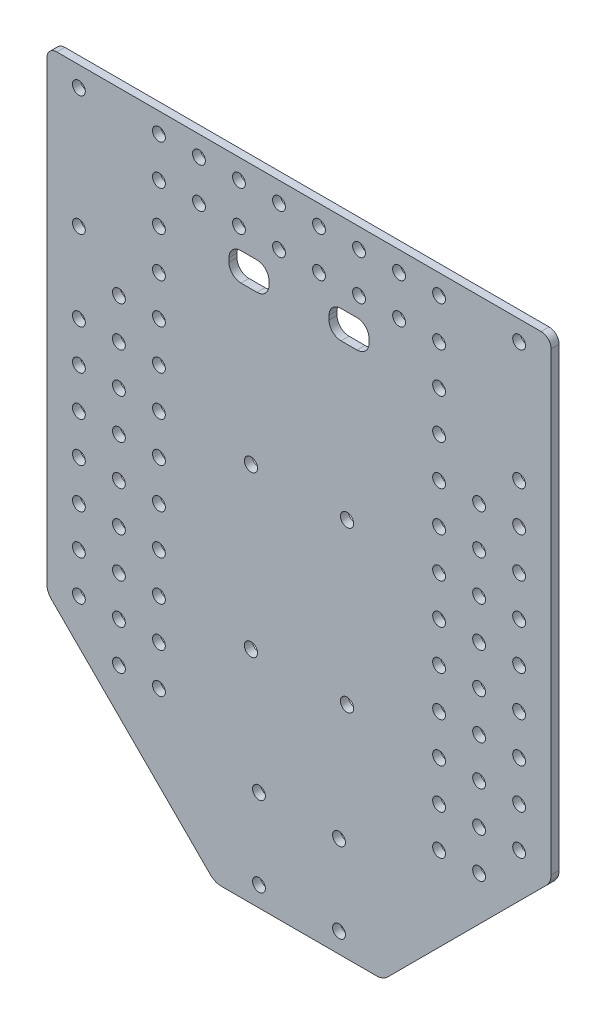
from build123d import *

# Parameters (mm, degrees)
SKETCH_1_W              = 126
SKETCH_1_H              = 160
EXTRUDE_428_DEPTH       = 2
CUT_EXTRUDE_998_REACH   = 173.968
SKETCH_2_R              = 1.6
SKETCH_3_R              = 1.65
CUT_EXTRUDE_1272_DEPTH  = 172.968020283
CHAMFER_2_SIZE          = 42
CHAMFER_1_SIZE          = 42
FILLET_1_R              = 4
SKETCH_6_W              = 10
SKETCH_6_H              = 7
CUT_EXTRUDE_2010_DEPTH  = 172.968020283
SKETCH_4_R              = 1.6
CUT_EXTRUDE_10_10_DEPTH = 172.968020283
FILLET_2_R              = 3
FILLET_3_R              = 2.5


with BuildPart() as part:
    # Эскиз1 → Extrude 428 (new body)
    with BuildSketch(Plane.XY):
        with Locations((0, -80)):
            Rectangle(SKETCH_1_W, SKETCH_1_H)
    extrude(amount=EXTRUDE_428_DEPTH)

    # Эскиз2 → Cut-Extrude 998 (cut, up to next)
    with BuildSketch(Plane.XY.offset(2), mode=Mode.PRIVATE) as cut_extrude_998_sk1:
        with Locations((10, -135)):
            Circle(SKETCH_2_R)
    cut_extrude_998_tool1 = extrude(cut_extrude_998_sk1.sketch, amount=-CUT_EXTRUDE_998_REACH, mode=Mode.PRIVATE) & part.part
    # Эскиз2 → Cut-Extrude 998 (cut, up to next)
    with BuildSketch(Plane.XY.offset(2), mode=Mode.PRIVATE) as cut_extrude_998_sk2:
        with Locations((-10, -135)):
            Circle(SKETCH_2_R)
    cut_extrude_998_tool2 = extrude(cut_extrude_998_sk2.sketch, amount=-CUT_EXTRUDE_998_REACH, mode=Mode.PRIVATE) & part.part
    # Эскиз2 → Cut-Extrude 998 (cut, up to next)
    with BuildSketch(Plane.XY.offset(2), mode=Mode.PRIVATE) as cut_extrude_998_sk3:
        with Locations((-10, -155)):
            Circle(SKETCH_2_R)
    cut_extrude_998_tool3 = extrude(cut_extrude_998_sk3.sketch, amount=-CUT_EXTRUDE_998_REACH, mode=Mode.PRIVATE) & part.part
    # Эскиз2 → Cut-Extrude 998 (cut, up to next)
    with BuildSketch(Plane.XY.offset(2), mode=Mode.PRIVATE) as cut_extrude_998_sk4:
        with Locations((10, -155)):
            Circle(SKETCH_2_R)
    cut_extrude_998_tool4 = extrude(cut_extrude_998_sk4.sketch, amount=-CUT_EXTRUDE_998_REACH, mode=Mode.PRIVATE) & part.part
    add(cut_extrude_998_tool1.solids().sort_by_distance((10, -135, 2))[0], mode=Mode.SUBTRACT)
    add(cut_extrude_998_tool2.solids().sort_by_distance((-10, -135, 2))[0], mode=Mode.SUBTRACT)
    add(cut_extrude_998_tool3.solids().sort_by_distance((-10, -155, 2))[0], mode=Mode.SUBTRACT)
    add(cut_extrude_998_tool4.solids().sort_by_distance((10, -155, 2))[0], mode=Mode.SUBTRACT)

    # Эскиз3 → Cut-Extrude 1272 (cut, through all)
    with BuildSketch(Plane(origin=(0, 0, 0), x_dir=(-1, 0, 0), z_dir=(0, 0, -1))):
        with Locations((-12, -65)):
            Circle(SKETCH_3_R)
        with Locations((12, -65)):
            Circle(SKETCH_3_R)
        with Locations((12, -105)):
            Circle(SKETCH_3_R)
        with Locations((-12, -105)):
            Circle(SKETCH_3_R)
    extrude(amount=-CUT_EXTRUDE_1272_DEPTH, mode=Mode.SUBTRACT)

    # Фаска2
    chamfer_2_edges = [part.edges().sort_by_distance(p)[0] for p in [
        (-63, -160, 1),
    ]]
    chamfer(chamfer_2_edges, length=CHAMFER_2_SIZE)

    # Фаска1
    chamfer_1_edges = [part.edges().sort_by_distance(p)[0] for p in [
        (63, -160, 1),
    ]]
    chamfer(chamfer_1_edges, length=CHAMFER_1_SIZE)

    # Скругление1
    fillet_1_edges = [part.edges().sort_by_distance(p)[0] for p in [
        (63, -118, 1),
        (-63, -118, 1),
        (-21, -160, 1),
        (21, -160, 1),
    ]]
    fillet(fillet_1_edges, radius=FILLET_1_R)

    # Эскиз6 → Cut-Extrude 2010 (cut, through all)
    with BuildSketch(Plane(origin=(0, 0, 0), x_dir=(-1, 0, 0), z_dir=(0, 0, -1))):
        with Locations((-12.5, -23.5)):
            Rectangle(SKETCH_6_W, SKETCH_6_H)
        with Locations((12.5, -23.5)):
            Rectangle(SKETCH_6_W, SKETCH_6_H)
    extrude(amount=-CUT_EXTRUDE_2010_DEPTH, mode=Mode.SUBTRACT)

    # Эскиз4 → Сетка отв 10х10 (cut, through all)
    with BuildSketch(Plane(origin=(0, 0, 0), x_dir=(-1, 0, 0), z_dir=(0, 0, -1))):
        with Locations((35, -125)):
            Circle(SKETCH_4_R)
        with Locations((45, -125)):
            Circle(SKETCH_4_R)
        with Locations((-45, -125)):
            Circle(SKETCH_4_R)
        with Locations((-35, -125)):
            Circle(SKETCH_4_R)
        with Locations((35, -115)):
            Circle(SKETCH_4_R)
        with Locations((45, -115)):
            Circle(SKETCH_4_R)
        with Locations((55, -115)):
            Circle(SKETCH_4_R)
        with Locations((-55, -115)):
            Circle(SKETCH_4_R)
        with Locations((-45, -115)):
            Circle(SKETCH_4_R)
        with Locations((-35, -115)):
            Circle(SKETCH_4_R)
        with Locations((35, -105)):
            Circle(SKETCH_4_R)
        with Locations((45, -105)):
            Circle(SKETCH_4_R)
        with Locations((55, -105)):
            Circle(SKETCH_4_R)
        with Locations((-55, -105)):
            Circle(SKETCH_4_R)
        with Locations((-45, -105)):
            Circle(SKETCH_4_R)
        with Locations((-35, -105)):
            Circle(SKETCH_4_R)
        with Locations((35, -95)):
            Circle(SKETCH_4_R)
        with Locations((45, -95)):
            Circle(SKETCH_4_R)
        with Locations((55, -95)):
            Circle(SKETCH_4_R)
        with Locations((-55, -95)):
            Circle(SKETCH_4_R)
        with Locations((-45, -95)):
            Circle(SKETCH_4_R)
        with Locations((-35, -95)):
            Circle(SKETCH_4_R)
        with Locations((35, -85)):
            Circle(SKETCH_4_R)
        with Locations((45, -85)):
            Circle(SKETCH_4_R)
        with Locations((55, -85)):
            Circle(SKETCH_4_R)
        with Locations((-55, -85)):
            Circle(SKETCH_4_R)
        with Locations((-45, -85)):
            Circle(SKETCH_4_R)
        with Locations((-35, -85)):
            Circle(SKETCH_4_R)
        with Locations((35, -75)):
            Circle(SKETCH_4_R)
        with Locations((45, -75)):
            Circle(SKETCH_4_R)
        with Locations((55, -75)):
            Circle(SKETCH_4_R)
        with Locations((-55, -75)):
            Circle(SKETCH_4_R)
        with Locations((-45, -75)):
            Circle(SKETCH_4_R)
        with Locations((-35, -75)):
            Circle(SKETCH_4_R)
        with Locations((35, -65)):
            Circle(SKETCH_4_R)
        with Locations((45, -65)):
            Circle(SKETCH_4_R)
        with Locations((55, -65)):
            Circle(SKETCH_4_R)
        with Locations((-55, -65)):
            Circle(SKETCH_4_R)
        with Locations((-45, -65)):
            Circle(SKETCH_4_R)
        with Locations((-35, -65)):
            Circle(SKETCH_4_R)
        with Locations((35, -55)):
            Circle(SKETCH_4_R)
        with Locations((45, -55)):
            Circle(SKETCH_4_R)
        with Locations((55, -55)):
            Circle(SKETCH_4_R)
        with Locations((-55, -55)):
            Circle(SKETCH_4_R)
        with Locations((-45, -55)):
            Circle(SKETCH_4_R)
        with Locations((-35, -55)):
            Circle(SKETCH_4_R)
        with Locations((35, -45)):
            Circle(SKETCH_4_R)
        with Locations((45, -45)):
            Circle(SKETCH_4_R)
        with Locations((-55, -45)):
            Circle(SKETCH_4_R)
        with Locations((-45, -45)):
            Circle(SKETCH_4_R)
        with Locations((-35, -45)):
            Circle(SKETCH_4_R)
        with Locations((35, -35)):
            Circle(SKETCH_4_R)
        with Locations((55, -35)):
            Circle(SKETCH_4_R)
        with Locations((-55, -35)):
            Circle(SKETCH_4_R)
        with Locations((-35, -35)):
            Circle(SKETCH_4_R)
        with Locations((35, -25)):
            Circle(SKETCH_4_R)
        with Locations((-35, -25)):
            Circle(SKETCH_4_R)
        with Locations((5, -15)):
            Circle(SKETCH_4_R)
        with Locations((15, -15)):
            Circle(SKETCH_4_R)
        with Locations((25, -15)):
            Circle(SKETCH_4_R)
        with Locations((35, -15)):
            Circle(SKETCH_4_R)
        with Locations((-35, -15)):
            Circle(SKETCH_4_R)
        with Locations((-25, -15)):
            Circle(SKETCH_4_R)
        with Locations((-15, -15)):
            Circle(SKETCH_4_R)
        with Locations((-5, -15)):
            Circle(SKETCH_4_R)
        with Locations((5, -5)):
            Circle(SKETCH_4_R)
        with Locations((15, -5)):
            Circle(SKETCH_4_R)
        with Locations((25, -5)):
            Circle(SKETCH_4_R)
        with Locations((35, -5)):
            Circle(SKETCH_4_R)
        with Locations((55, -5)):
            Circle(SKETCH_4_R)
        with Locations((-55, -5)):
            Circle(SKETCH_4_R)
        with Locations((-35, -5)):
            Circle(SKETCH_4_R)
        with Locations((-25, -5)):
            Circle(SKETCH_4_R)
        with Locations((-15, -5)):
            Circle(SKETCH_4_R)
        with Locations((-5, -5)):
            Circle(SKETCH_4_R)
    extrude(amount=-CUT_EXTRUDE_10_10_DEPTH, mode=Mode.SUBTRACT)

    # Скругление2
    fillet_2_edges = [part.edges().sort_by_distance(p)[0] for p in [
        (7.5, -27, 1),
        (7.5, -20, 1),
        (17.5, -27, 1),
        (17.5, -20, 1),
        (-7.5, -27, 1),
        (-17.5, -27, 1),
        (-17.5, -20, 1),
        (-7.5, -20, 1),
    ]]
    fillet(fillet_2_edges, radius=FILLET_2_R)

    # Скругление3
    fillet_3_edges = [part.edges().sort_by_distance(p)[0] for p in [
        (63, 0, 1),
        (-63, 0, 1),
    ]]
    fillet(fillet_3_edges, radius=FILLET_3_R)


solid = part.part
